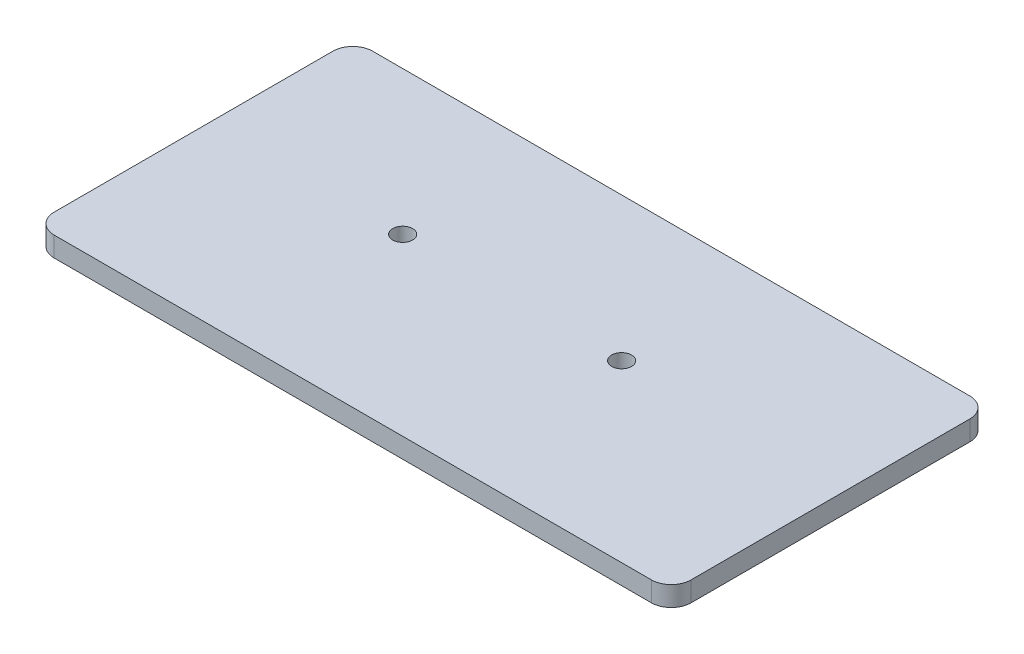
from build123d import *

# Parameters (mm, degrees)
SKETCH1_W                   = 203.2
SKETCH1_H                   = 101.6
BOSS_EXTRUDE1_DEPTH         = 6.35
F_1_4_0_25_DIAMETER_HOLE1_D = 6.35
FILLET1_R                   = 6.35


with BuildPart() as part:
    # Sketch1 → Boss-Extrude1 (new body)
    with BuildSketch(Plane(origin=(0, 0, 0), x_dir=(1, 0, 0), z_dir=(0, 1, 0))):
        with Locations((101.6, 50.8)):
            Rectangle(SKETCH1_W, SKETCH1_H)
    extrude(amount=BOSS_EXTRUDE1_DEPTH)

    # 1/4 (0.25) Diameter Hole1 (through all)
    with Locations(Plane(origin=(0, 6.35, 0), x_dir=(1, 0, 0), z_dir=(0, 1, 0))):
        with Locations((61.726765383, 55.793470503), (131.576765383, 55.793470503)):
            Hole(F_1_4_0_25_DIAMETER_HOLE1_D / 2)

    # Fillet1
    fillet1_edges = [part.edges().sort_by_distance(p)[0] for p in [
        (203.2, 3.175, 0),
        (203.2, 3.175, -101.6),
        (0, 3.175, -101.6),
        (0, 3.175, 0),
    ]]
    fillet(fillet1_edges, radius=FILLET1_R)


solid = part.part
